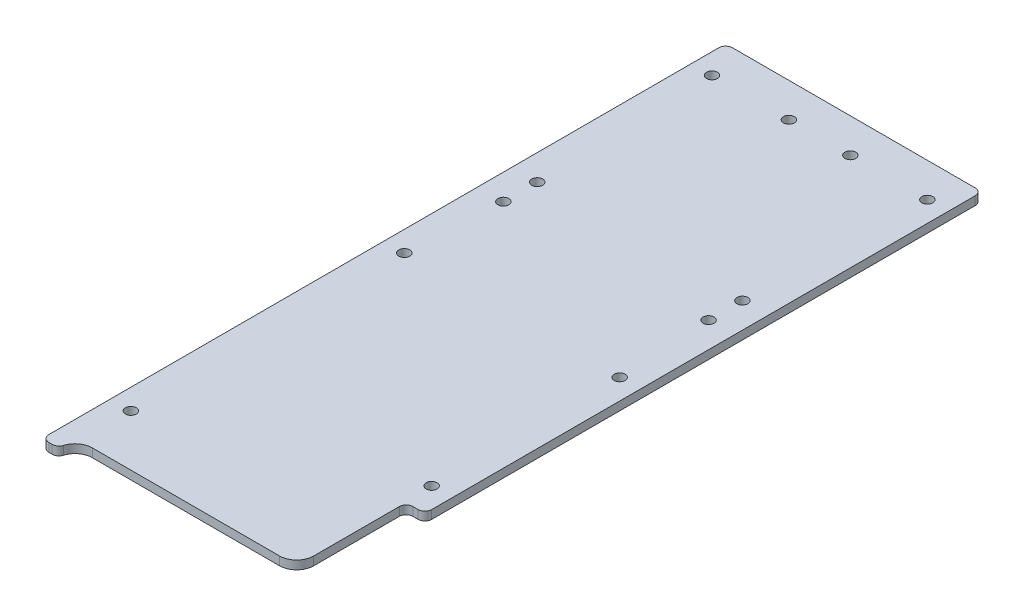
from build123d import *

# Parameters (mm, degrees)
SKETCH1_R           = 2.032
BOSS_EXTRUDE1_DEPTH = 3.175
FILLET1_R           = 2.54
FILLET2_R           = 2.54
FILLET3_R           = 6.35
CUT_EXTRUDE1_DEPTH  = 136.673215063
FILLET4_R           = 6.35
FILLET5_R           = 2.54
SKETCH3_R           = 2.032
CUT_EXTRUDE2_DEPTH  = 136.673215063


with BuildPart() as part:
    # Sketch1 → Boss-Extrude1 (new body)
    with BuildSketch(Plane(origin=(0, 0, 0), x_dir=(1, 0, 0), z_dir=(0, 1, 0))):
        Polygon((47.625, 127), (-47.625, 127), (-47.625, -127), (-41.275, -127), (-41.275, -120.65), (41.275, -120.65), (41.275, -127), (47.625, -127), align=None)
        with Locations((-39.999684148, -101.6)):
            Circle(SKETCH1_R, mode=Mode.SUBTRACT)
        with Locations((39.999684148, -69.85)):
            Circle(SKETCH1_R, mode=Mode.SUBTRACT)
        with Locations((-39.999684148, 0)):
            Circle(SKETCH1_R, mode=Mode.SUBTRACT)
        with Locations((-39.999684148, 114.3)):
            Circle(SKETCH1_R, mode=Mode.SUBTRACT)
        with Locations((-11.424684148, 114.3)):
            Circle(SKETCH1_R, mode=Mode.SUBTRACT)
        with Locations((39.999684148, 0)):
            Circle(SKETCH1_R, mode=Mode.SUBTRACT)
        with Locations((11.424684148, 114.3)):
            Circle(SKETCH1_R, mode=Mode.SUBTRACT)
        with Locations((39.999684148, 114.3)):
            Circle(SKETCH1_R, mode=Mode.SUBTRACT)
    extrude(amount=BOSS_EXTRUDE1_DEPTH)

    # Fillet1
    fillet1_edges = [part.edges().sort_by_distance(p)[0] for p in [
        (-47.625, 1.5875, -127),
        (47.625, 1.5875, -127),
        (47.625, 1.5875, 127),
        (-47.625, 1.5875, 127),
    ]]
    fillet(fillet1_edges, radius=FILLET1_R)

    # Fillet2
    fillet2_edges = [part.edges().sort_by_distance(p)[0] for p in [
        (41.275, 1.5875, 127),
        (-41.275, 1.5875, 127),
    ]]
    fillet(fillet2_edges, radius=FILLET2_R)

    # Fillet3
    fillet3_edges = [part.edges().sort_by_distance(p)[0] for p in [
        (41.275, 1.5875, 120.65),
        (-41.275, 1.5875, 120.65),
    ]]
    fillet(fillet3_edges, radius=FILLET3_R)

    # Sketch2 → Cut-Extrude1 (cut, through all)
    with BuildSketch(Plane.XZ):
        with BuildLine():
            Line((47.625, 131.883089137), (41.910383243, 131.883089137))
            Line((41.910383243, 131.883089137), (41.910383243, 126.140486539))
            ThreePointArc((41.910383243, 126.140486539), (41.59372648, 125.691886337), (41.380880287, 125.185714286))
            ThreePointArc((41.380880287, 125.185714286), (41.067352146, 124.352518574), (40.640383243, 123.57135755))
            Line((40.640383243, 123.57135755), (40.640383243, 79.981419179))
            Line((40.640383243, 79.981419179), (47.625, 79.981419179))
            Line((47.625, 79.981419179), (47.625, 131.883089137))
        make_face()
    extrude(amount=-CUT_EXTRUDE1_DEPTH, mode=Mode.SUBTRACT)

    # Fillet4
    fillet4_edges = [part.edges().sort_by_distance(p)[0] for p in [
        (40.640383243, 1.5875, 123.57135755),
    ]]
    fillet(fillet4_edges, radius=FILLET4_R)

    # Fillet5
    fillet5_edges = [part.edges().sort_by_distance(p)[0] for p in [
        (47.625, 1.5875, 79.981419179),
        (40.640383243, 1.5875, 79.981419179),
    ]]
    fillet(fillet5_edges, radius=FILLET5_R)

    # Sketch3 → Cut-Extrude2 (cut, through all)
    with BuildSketch(Plane.XZ):
        with Locations((-38.113540183, -34.913768806)):
            Circle(SKETCH3_R)
        with Locations((-38.113540183, -47.490173279)):
            Circle(SKETCH3_R)
        with Locations((38.113540183, -47.490173279)):
            Circle(SKETCH3_R)
        with Locations((38.113540183, -34.913768806)):
            Circle(SKETCH3_R)
    extrude(amount=-CUT_EXTRUDE2_DEPTH, mode=Mode.SUBTRACT)


solid = part.part
